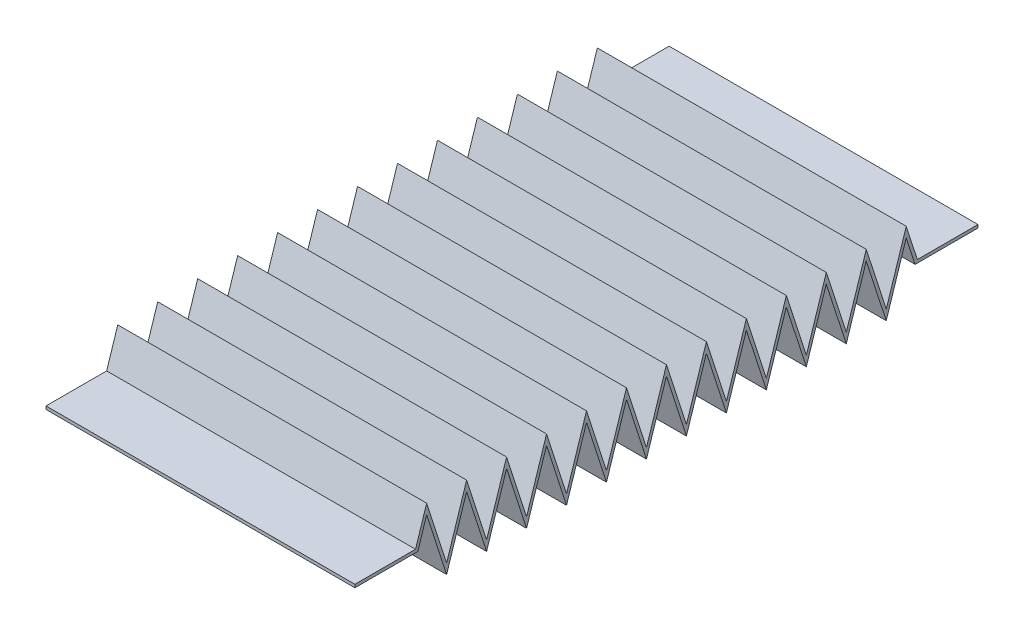
from build123d import *

# Parameters (mm, degrees)
EXTRUDE_THIN1_DEPTH = 25


with BuildPart() as part:
    # Sketch3 → Extrude-Thin1 (new, symmetric)
    with BuildSketch(Plane(origin=(0, 0, 0), x_dir=(0, 0, -1), z_dir=(1, 0, 0))):
        Polygon((0, 4.75), (10.181885777, 4.75), (11.617364725, 9.187709459), (14.852094174, -0.812290541), (18.086823624, 9.187709459), (21.321553074, -0.812290541), (24.556282523, 9.187709459), (27.791011973, -0.812290541), (31.025741423, 9.187709459), (34.260470872, -0.812290541), (37.495200322, 9.187709459), (40.729929772, -0.812290541), (43.964659221, 9.187709459), (47.199388671, -0.812290541), (50.434118121, 9.187709459), (53.66884757, -0.812290541), (56.90357702, 9.187709459), (60.13830647, -0.812290541), (63.373035919, 9.187709459), (66.607765369, -0.812290541), (69.842494819, 9.187709459), (73.077224268, -0.812290541), (76.311953718, 9.187709459), (79.546683167, -0.812290541), (82.781412617, 9.187709459), (86.016142067, -0.812290541), (89.250871516, 9.187709459), (90.686350464, 4.75), (100.868236241, 4.75), (100.868236241, 5.25), (91.050122019, 5.25), (89.250871516, 10.812290541), (86.016142067, 0.812290541), (82.781412617, 10.812290541), (79.546683167, 0.812290541), (76.311953718, 10.812290541), (73.077224268, 0.812290541), (69.842494819, 10.812290541), (66.607765369, 0.812290541), (63.373035919, 10.812290541), (60.13830647, 0.812290541), (56.90357702, 10.812290541), (53.66884757, 0.812290541), (50.434118121, 10.812290541), (47.199388671, 0.812290541), (43.964659221, 10.812290541), (40.729929772, 0.812290541), (37.495200322, 10.812290541), (34.260470872, 0.812290541), (31.025741423, 10.812290541), (27.791011973, 0.812290541), (24.556282523, 10.812290541), (21.321553074, 0.812290541), (18.086823624, 10.812290541), (14.852094174, 0.812290541), (11.617364725, 10.812290541), (9.818114223, 5.25), (0, 5.25), align=None)
    extrude(amount=EXTRUDE_THIN1_DEPTH, both=True)


solid = part.part
